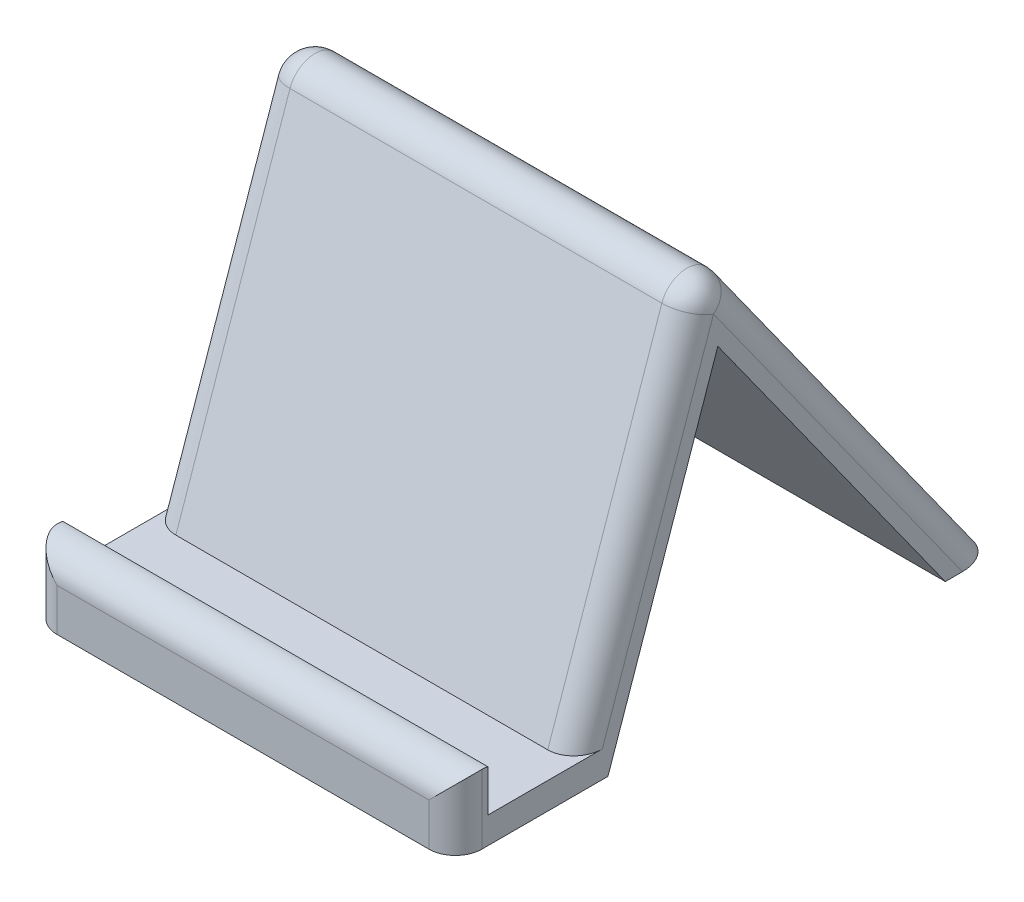
from build123d import *

# Parameters (mm, degrees)
BASE_W                  = 80
BASE_H                  = 101.6
BOSS_EXTRUDE1_DEPTH     = 76.2
SKETCH2_OUTSIDE_W       = 133.62
SKETCH2_OUTSIDE_H       = 108.22
CUT_EXTRUDE1_DEPTH      = 122.602138139
CUT_EXTRUDE2_DEPTH      = 122.602138139
CUT_EXTRUDE5_DEPTH      = 122.602138139
CUT_EXTRUDE5_DEPTH_BACK = 122.602138139
FILLET9_R               = 5


with BuildPart() as part:
    # Base → Boss-Extrude1 (new body)
    with BuildSketch(Plane(origin=(0, 0, 0), x_dir=(1, 0, 0), z_dir=(0, 1, 0))):
        Rectangle(BASE_W, BASE_H)
    extrude(amount=BOSS_EXTRUDE1_DEPTH)

    # Sketch2 outside → Cut-Extrude1 (cut, through all)
    with BuildSketch(Plane.ZY.offset(40)):
        with Locations((0, 38.1)):
            Rectangle(SKETCH2_OUTSIDE_W, SKETCH2_OUTSIDE_H)
        Polygon((-50.8, 0), (3.783173521, 76.2), (27.722793107, 7.014775443), (50.8, 15), (50.8, 0), align=None, mode=Mode.SUBTRACT)
    extrude(amount=-CUT_EXTRUDE1_DEPTH, mode=Mode.SUBTRACT)

    # Sketch3 → Cut-Extrude2 (cut, through all)
    with BuildSketch(Plane.ZY.offset(40)):
        Polygon((-41.426759988, 0), (22.086778061, 0), (1.39927914, 59.786633335), align=None)
    extrude(amount=-CUT_EXTRUDE2_DEPTH, mode=Mode.SUBTRACT)

    # Sketch4 → Cut-Extrude5 (cut, two sides: drawn at the far end of the back side and taken through both)
    with BuildSketch(Plane.ZY.offset(40).offset(-CUT_EXTRUDE5_DEPTH_BACK)):
        Polygon((-50.478149223, 233.014597048), (27.722793107, 7.014775443), (28.419950021, 5), (44.690435309, 5), (44.690435309, 12.88595534), (44.690435309, 252.032995353), (-49.038158805, 721.053440145), (-144.206743336, 702.035041841), align=None)
    extrude(amount=CUT_EXTRUDE5_DEPTH + CUT_EXTRUDE5_DEPTH_BACK, mode=Mode.SUBTRACT)

    # Fillet9
    # the kernel refuses this fillet: 5 mm, written as the material it takes off along each edge
    with BuildSketch(Plane(origin=(35, 65.430074367, 2.218938363), x_dir=(0, 0.3269994156125086, 0.9450245405221379), z_dir=(1, 0, 0))) as fillet9_piece_1_section:
        Polygon((0, 0), (FILLET9_R * 1.02, 0), (FILLET9_R * 1.02, -FILLET9_R * 1.97193336822), (-FILLET9_R * 0.58939542952, -FILLET9_R * 0.832474040232), align=None)
    fillet9_piece_1 = extrude(amount=FILLET9_R * 1.02, mode=Mode.PRIVATE)
    fillet9_piece_1 = fillet9_piece_1 - Plane(origin=(35, 65.430074367, 2.218938363), x_dir=(0, -0.9896165143253448, -0.14373292794121578), z_dir=(1, 0, 0)) * Sphere(FILLET9_R, mode=Mode.PRIVATE)
    add(fillet9_piece_1, mode=Mode.SUBTRACT)
    with BuildSketch(Plane(origin=(-35, 65.430074367, 2.218938363), x_dir=(0, 0.5823298395581055, -0.8129526172909656), z_dir=(-1, 0, 0))) as fillet9_piece_2_section:
        Polygon((0, 0), (FILLET9_R * 1.02, 0), (FILLET9_R * 1.02, -FILLET9_R * 1.97193336822), (-FILLET9_R * 0.58939542952, -FILLET9_R * 0.832474040232), align=None)
    fillet9_piece_2 = extrude(amount=FILLET9_R * 1.02, mode=Mode.PRIVATE)
    fillet9_piece_2 = fillet9_piece_2 - Plane(origin=(-35, 65.430074367, 2.218938363), x_dir=(0, -0.9896165143253448, -0.14373292794121578), z_dir=(-1, 0, 0)) * Sphere(FILLET9_R, mode=Mode.PRIVATE)
    add(fillet9_piece_2, mode=Mode.SUBTRACT)
    with BuildSketch(Plane(origin=(40, 67.065071445, 6.944061066), x_dir=(-1, 0, 0), z_dir=(0, -0.9450245405221379, 0.32699941561250884))) as fillet9_piece_3_section:
        with BuildLine():
            CenterArc((FILLET9_R, FILLET9_R), FILLET9_R, 180, 90)
            Line((0, FILLET9_R), (0, 0))
            Line((0, 0), (FILLET9_R, 0))
        make_face()
    fillet9_piece_3 = extrude(amount=78.175618763, mode=Mode.PRIVATE)
    fillet9_piece_3 = split(fillet9_piece_3, bisect_by=Plane(origin=(40, 5, 6.944061066), z_dir=(0, 1, 0)), keep=Keep.TOP, mode=Mode.PRIVATE)
    add(fillet9_piece_3, mode=Mode.SUBTRACT)
    with BuildSketch(Plane(origin=(40, -12.5, 50.8), x_dir=(-1, 0, 0), z_dir=(0, 1, 0))) as fillet9_piece_4:
        with BuildLine():
            CenterArc((FILLET9_R, -FILLET9_R), FILLET9_R, 90, 90)
            Line((0, -FILLET9_R), (0, 0))
            Line((0, 0), (FILLET9_R, 0))
        make_face()
    extrude(amount=40, mode=Mode.SUBTRACT)
    with BuildSketch(Plane(origin=(-57.473442698, 15, 50.8), x_dir=(0, -0.32699941561252693, -0.9450245405221316), z_dir=(1, 0, 0))) as fillet9_piece_5:
        with BuildLine():
            CenterArc((7.010644923, -4.970135785), FILLET9_R, 96.265339119, 102.821413949)
            Line((2.28552222, -6.605132863), (0, 0))
            Line((0, 0), (6.464979934, 0))
        make_face()
    extrude(amount=114.946885396, mode=Mode.SUBTRACT)
    with BuildSketch(Plane(origin=(-40, -12.5, 50.8), x_dir=(1, 0, 0), z_dir=(0, 1, 0))) as fillet9_piece_6:
        with BuildLine():
            CenterArc((FILLET9_R, FILLET9_R), FILLET9_R, 180, 90)
            Line((0, FILLET9_R), (0, 0))
            Line((0, 0), (FILLET9_R, 0))
        make_face()
    extrude(amount=40, mode=Mode.SUBTRACT)
    with BuildSketch(Plane(origin=(-40, -6.812806757, 32.507442716), x_dir=(1, 0, 0), z_dir=(0, 0.9450245405221379, -0.32699941561250884))) as fillet9_piece_7_section:
        with BuildLine():
            CenterArc((FILLET9_R, FILLET9_R), FILLET9_R, 180, 90)
            Line((0, FILLET9_R), (0, 0))
            Line((0, 0), (FILLET9_R, 0))
        make_face()
    fillet9_piece_7 = extrude(amount=78.175618763, mode=Mode.PRIVATE)
    fillet9_piece_7 = split(fillet9_piece_7, bisect_by=Plane(origin=(-40, 5, 32.507442716), z_dir=(0, 1, 0)), keep=Keep.TOP, mode=Mode.PRIVATE)
    add(fillet9_piece_7, mode=Mode.SUBTRACT)
    with BuildSketch(Plane(origin=(-40, -10.161907716, -58.079122994), x_dir=(1, 0, 0), z_dir=(0, 0.8129526172909656, 0.5823298395581055)), Plane(origin=(40, 68.341723565, -1.845824723), x_dir=(-1, 0, 0), z_dir=(0, -0.8129526172909656, -0.5823298395581055))) as fillet9_piece_8:
        with BuildLine():
            CenterArc((FILLET9_R, -FILLET9_R), FILLET9_R, 90, 90)
            Line((0, -FILLET9_R), (0, 0))
            Line((0, 0), (FILLET9_R, 0))
        make_face()
    extrude(amount=96.566060077, mode=Mode.SUBTRACT)
    with BuildSketch(Plane(origin=(-35, 76.2, 3.783173521), x_dir=(0, -0.8129526172909656, -0.5823298395581056), z_dir=(1, 0, 0))) as fillet9_piece_9:
        with BuildLine():
            CenterArc((FILLET9_R * 1.93326800806, -FILLET9_R), FILLET9_R, 90, 125.29866839)
            Line((FILLET9_R * 1.11711698822, -FILLET9_R * 1.57783865639), (0, 0))
            Line((0, 0), (FILLET9_R * 1.93326800806, 0))
        make_face()
    extrude(amount=70, mode=Mode.SUBTRACT)


solid = part.part
